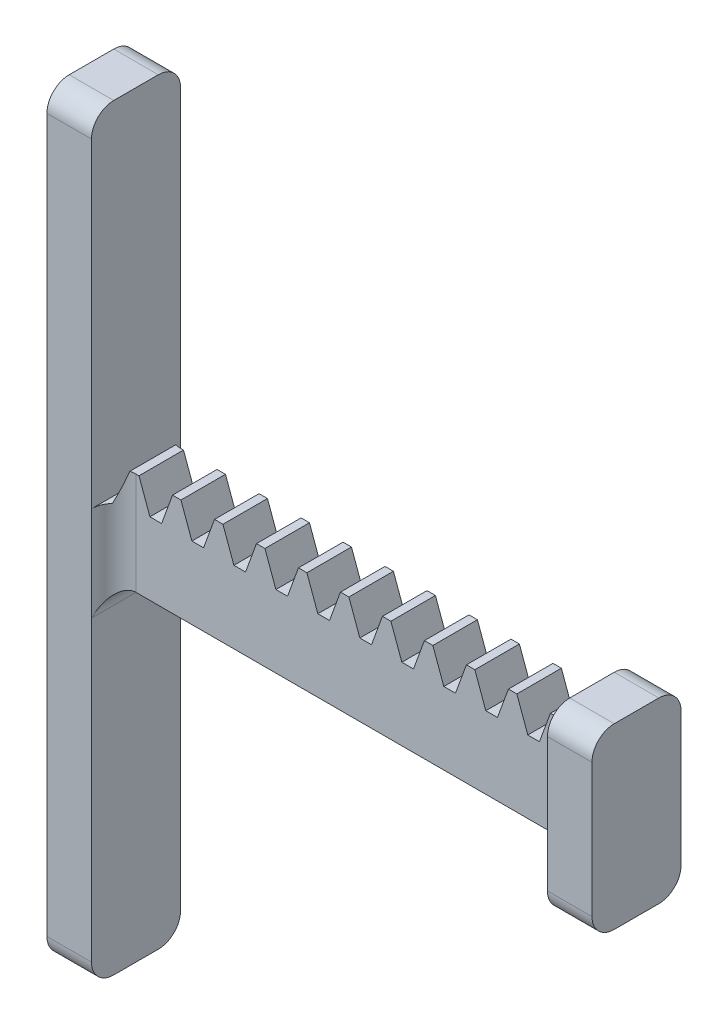
from build123d import *

# Parameters (mm, degrees)
BLANKSKE_W                   = 100
BLANKSKE_H                   = 11.5
BLANK_DEPTH                  = 5
TOOTHCUTSIM_DEPTH            = 101.783183121
TEETHCUTS_COUNT              = 22
TEETHCUTS_PITCH              = 4.712388975
BOSS_EXTRU_1_DEPTH           = 5
BOSS_EXTRU_2_DEPTH           = 5
CONG_2_R                     = 2.5
CONG_3_R                     = 2.5
CONG_4_R                     = 2.5
ENL_V_MAT_EXTRU_1_DEPTH      = 116.139334748
ENL_V_MAT_EXTRU_1_DEPTH_BACK = 116.139334748
ESQUISSE4_W                  = 53.825648792
ESQUISSE4_H                  = 17.774257486
BOSS_EXTRU_3_DEPTH           = 5


with BuildPart() as part:
    # BlankSke → Blank (new body)
    with BuildSketch(Plane.XY):
        with Locations((50, 5.75)):
            Rectangle(BLANKSKE_W, BLANKSKE_H)
    extrude(amount=-BLANK_DEPTH)

    # TooCutSkeSim → ToothCutSim (cut, through all)
    with BuildSketch(Plane.XY):
        Polygon((0.654653055, 8.125), (-0.654653055, 8.125), (-1.892297439, 11.5254), (1.892297439, 11.5254), align=None)
    toothcutsim = extrude(amount=-TOOTHCUTSIM_DEPTH, mode=Mode.SUBTRACT)

    # TeethCuts: ToothCutSim ×22
    with Locations(*[(i * TEETHCUTS_PITCH, 0, 0) for i in range(1, TEETHCUTS_COUNT)]):
        add(toothcutsim, mode=Mode.SUBTRACT)

    # Esquisse1 → Boss.-Extru.1 (add)
    with BuildSketch(Plane(origin=(100, 0, 0), x_dir=(0, 0, -1), z_dir=(1, 0, 0))):
        with BuildLine():
            Line((5, 12.18326915), (0, 12.18326915))
            ThreePointArc((0, 12.18326915), (-2.121320344, 11.304589494), (-3, 9.18326915))
            Line((-3, 9.18326915), (-3, 0))
            ThreePointArc((-3, 0), (-2.121320344, -2.121320344), (0, -3))
            Line((0, -3), (5, -3))
            ThreePointArc((5, -3), (7.121320344, -2.121320344), (8, 0))
            Line((8, 0), (8, 9.18326915))
            ThreePointArc((8, 9.18326915), (7.121320344, 11.304589494), (5, 12.18326915))
        make_face()
    extrude(amount=BOSS_EXTRU_1_DEPTH)

    # Esquisse2 → Boss.-Extru.2 (add)
    with BuildSketch(Plane.ZY):
        with BuildLine():
            Line((-5, 46.5625), (0, 46.5625))
            ThreePointArc((0, 46.5625), (1.767766953, 45.830266953), (2.5, 44.0625))
            Line((2.5, 44.0625), (2.5, -35.9375))
            ThreePointArc((2.5, -35.9375), (1.767766953, -37.705266953), (0, -38.4375))
            Line((0, -38.4375), (-5, -38.4375))
            ThreePointArc((-5, -38.4375), (-6.767766953, -37.705266953), (-7.5, -35.9375))
            Line((-7.5, -35.9375), (-7.5, 44.0625))
            ThreePointArc((-7.5, 44.0625), (-6.767766953, 45.830266953), (-5, 46.5625))
        make_face()
    extrude(amount=BOSS_EXTRU_2_DEPTH)

    # Congé2
    cong_2_edges = [part.edges().sort_by_distance(p)[0] for p in [
        (0, 4.0625, -5),
    ]]
    fillet(cong_2_edges, radius=CONG_2_R - 0.0001)  # a hair under: the kernel refuses the full size

    # Congé3
    cong_3_edges = [part.edges().sort_by_distance(p)[0] for p in [
        (0, 4.0625, 0),
    ]]
    fillet(cong_3_edges, radius=CONG_3_R - 0.0001)  # a hair under: the kernel refuses the full size

    # Congé4
    cong_4_edges = [part.edges().sort_by_distance(p)[0] for p in [
        (0, 0, -2.5),
    ]]
    fillet(cong_4_edges, radius=CONG_4_R)

    # Esquisse4 → Enlèv. mat.-Extru.1 (cut, two sides: drawn at the far end of the back side and taken through both)
    with BuildSketch(Plane(origin=(0, 0, -5), x_dir=(-1, 0, 0), z_dir=(0, 0, -1)).offset(-ENL_V_MAT_EXTRU_1_DEPTH_BACK)):
        with Locations((-78.087175604, 5.887128743)):
            Rectangle(ESQUISSE4_W, ESQUISSE4_H)
    extrude(amount=ENL_V_MAT_EXTRU_1_DEPTH + ENL_V_MAT_EXTRU_1_DEPTH_BACK, mode=Mode.SUBTRACT)

    # Esquisse5 → Boss.-Extru.3 (add)
    with BuildSketch(Plane(origin=(51.174351208, 0, 0), x_dir=(0, 0, -1), z_dir=(1, 0, 0))):
        with BuildLine():
            Line((0, 14.07249321), (5, 14.07249321))
            ThreePointArc((5, 14.07249321), (6.767766953, 13.340260163), (7.5, 11.57249321))
            Line((7.5, 11.57249321), (7.5, -3.42750679))
            ThreePointArc((7.5, -3.42750679), (6.767766953, -5.195273743), (5, -5.92750679))
            Line((5, -5.92750679), (0, -5.92750679))
            ThreePointArc((0, -5.92750679), (-1.767766953, -5.195273743), (-2.5, -3.42750679))
            Line((-2.5, -3.42750679), (-2.5, 11.57249321))
            ThreePointArc((-2.5, 11.57249321), (-1.767766953, 13.340260163), (0, 14.07249321))
        make_face()
    extrude(amount=BOSS_EXTRU_3_DEPTH)


solid = part.part
